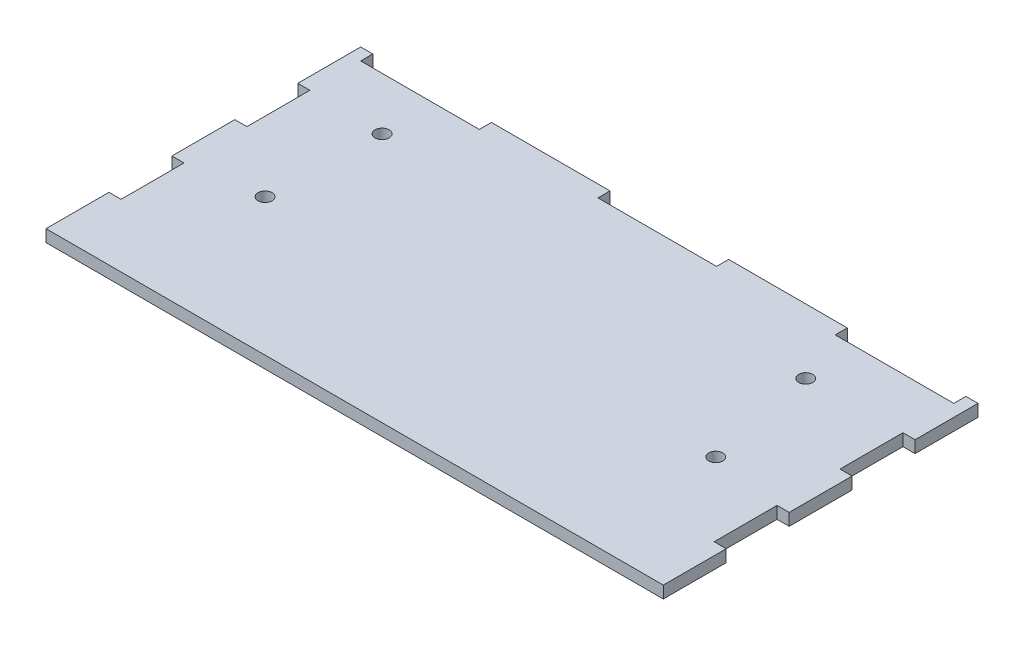
from build123d import *

# Parameters (mm, degrees)
SKETCH1_R           = 1.75
BOSS_EXTRUDE1_DEPTH = 3


with BuildPart() as part:
    # Sketch1 → Boss-Extrude1 (new body)
    with BuildSketch(Plane(origin=(0, 0, 0), x_dir=(1, 0, 0), z_dir=(0, 1, 0))):
        Polygon((-73.5, 33), (-44.1, 33), (-44.1, 36), (-14.7, 36), (-14.7, 33), (14.7, 33), (14.7, 36), (44.1, 36), (44.1, 33), (73.5, 33), (73.5, 36), (76.5, 36), (76.5, 20.4), (73.5, 20.4), (73.5, 4.8), (76.5, 4.8), (76.5, -10.8), (73.5, -10.8), (73.5, -26.4), (76.5, -26.4), (76.5, -42), (-76.5, -42), (-76.5, -26.4), (-73.5, -26.4), (-73.5, -10.8), (-76.5, -10.8), (-76.5, 4.8), (-73.5, 4.8), (-73.5, 20.4), (-76.5, 20.4), (-76.5, 36), (-73.5, 36), align=None)
        with Locations((-56.2, -8)):
            Circle(SKETCH1_R, mode=Mode.SUBTRACT)
        with Locations((-55.2, 20)):
            Circle(SKETCH1_R, mode=Mode.SUBTRACT)
        with Locations((49.8, 20)):
            Circle(SKETCH1_R, mode=Mode.SUBTRACT)
        with Locations((55.5, -8)):
            Circle(SKETCH1_R, mode=Mode.SUBTRACT)
    extrude(amount=BOSS_EXTRUDE1_DEPTH)


solid = part.part
